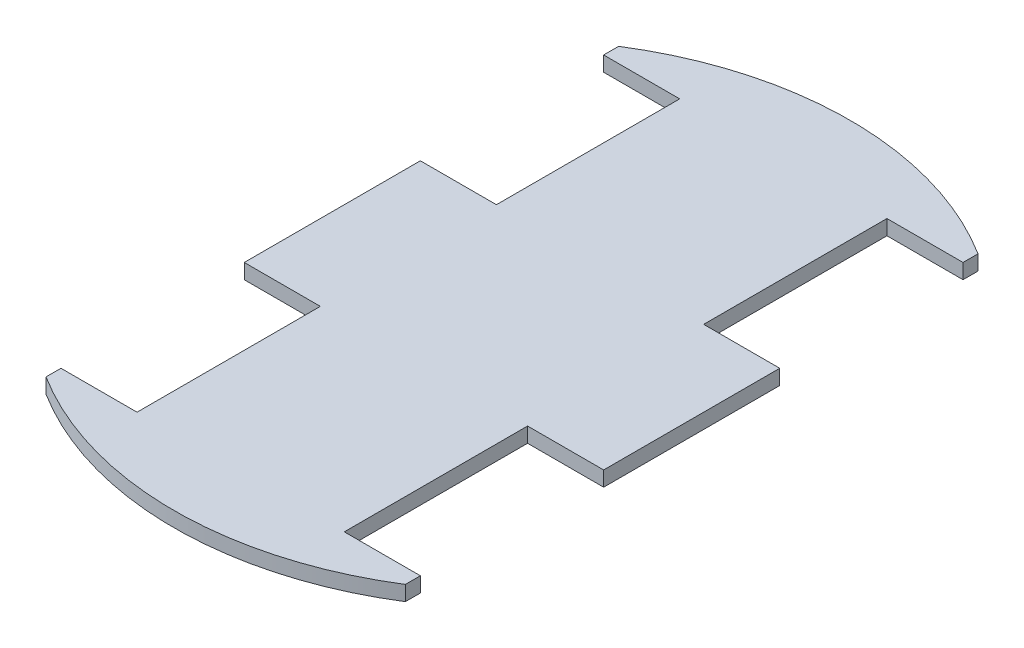
from build123d import *

# Parameters (mm, degrees)
CHASSIS_DEPTH = 6.35


with BuildPart() as part:
    # Sketch1 → Chassis (new body)
    with BuildSketch(Plane(origin=(0, 0, 0), x_dir=(1, 0, 0), z_dir=(0, 1, 0))):
        with BuildLine():
            Line((-76.2, -38.862), (-43.942, -38.862))
            Line((-43.942, -38.862), (-43.942, 38.862))
            Line((-43.942, 38.862), (-76.2, 38.862))
            Line((-76.2, 38.862), (-76.2, 45.212))
            ThreePointArc((-76.2, 45.212), (0, 67.143342168), (76.2, 45.212))
            Line((76.2, 45.212), (76.2, 38.862))
            Line((76.2, 38.862), (43.942, 38.862))
            Line((43.942, 38.862), (43.942, -38.862))
            Line((43.942, -38.862), (76.2, -38.862))
            Line((76.2, -38.862), (76.2, -113.538))
            Line((76.2, -113.538), (43.942, -113.538))
            Line((43.942, -113.538), (43.942, -191.262))
            Line((43.942, -191.262), (76.2, -191.262))
            Line((76.2, -191.262), (76.2, -197.612))
            ThreePointArc((76.2, -197.612), (0, -219.543342168), (-76.2, -197.612))
            Line((-76.2, -197.612), (-76.2, -191.262))
            Line((-76.2, -191.262), (-43.942, -191.262))
            Line((-43.942, -191.262), (-43.942, -113.538))
            Line((-43.942, -113.538), (-76.2, -113.538))
            Line((-76.2, -113.538), (-76.2, -38.862))
        make_face()
    extrude(amount=CHASSIS_DEPTH)


solid = part.part
